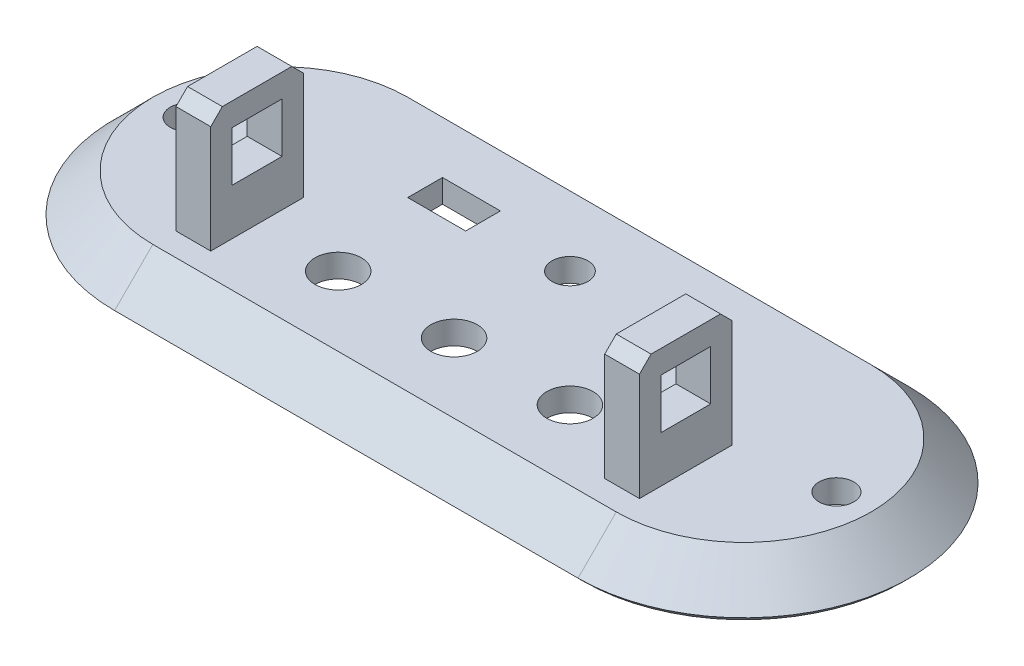
from build123d import *
from OCP.BRepFilletAPI import BRepFilletAPI_MakeChamfer

# Parameters (mm, degrees)
BOSS_EXTRU_1_DEPTH           = 3.8
BOSS_EXTRU_1_TAPER           = 45
COQUE2_DEPTH                 = 1.8
COQUE2_DRAFT                 = 45
CHANFREIN1_SIZE              = 1
CHANFREIN1_SIZE2             = 0.707106781
ENL_V_MAT_EXTRU_1_REACH      = 39.355
ESQUISSE2_R                  = 1.5
ENL_V_MAT_EXTRU_2_REACH      = 39.215
ESQUISSE3_R                  = 1.55
ESQUISSE3_R_2                = 2
ESQUISSE3_W                  = 5
ESQUISSE3_H                  = 3
ESQUISSE4_W                  = 4.3
ESQUISSE4_H                  = 4.3
BOSS_EXTRU_2_DEPTH           = 3
CHANFREIN2_SIZE              = 1
CHANFREIN2_OF_SYM_TRIE1_SIZE = 1


# Read off the part's stored shape, not the designer's step: Coque2
with BuildPart() as part:
    # Esquisse1 → Boss.-Extru.1 (new body)
    with BuildSketch(Plane(origin=(0, 0, 0), x_dir=(1, 0, 0), z_dir=(0, 1, 0))):
        with BuildLine():
            ThreePointArc((-20, 14.8), (-34.8, 0), (-20, -14.8))
            Line((-20, -14.8), (20, -14.8))
            ThreePointArc((20, -14.8), (34.8, 0), (20, 14.8))
            Line((20, 14.8), (-20, 14.8))
        make_face()
    extrude(amount=BOSS_EXTRU_1_DEPTH, taper=BOSS_EXTRU_1_TAPER)


with BuildPart() as coque2_tool:
    # Coque2 outline → Coque2 (with draft: the straight prism first)
    with BuildSketch(Plane(origin=(0, 1.8, 0), x_dir=(1, 0, 0), z_dir=(0, 1, 0))):
        with BuildLine():
            Line((-20, -10.171572875), (20, -10.171572875))
            ThreePointArc((20, -10.171572875), (30.171572875, 0), (20, 10.171572875))
            Line((20, 10.171572875), (-20, 10.171572875))
            ThreePointArc((-20, 10.171572875), (-30.171572875, 0), (-20, -10.171572875))
        make_face()
    extrude(amount=-COQUE2_DEPTH)
    # Coque2: the draft: its side faces are tilted about the plane it starts from
    coque2_sides = [coque2_tool.faces().sort_by_distance(p)[0] for p in [
        (0, 0.9, 10.171572875),
        (30.171572875, 0.9, 0),
        (0, 0.9, -10.171572875),
        (-30.171572875, 0.9, 0),
    ]]
    draft(coque2_sides, Plane(origin=(0, 1.8, 0), x_dir=(1, 0, 0), z_dir=(0, 1, 0)), COQUE2_DRAFT)


with BuildPart() as part_1:
    add(part.part)

    # Coque2: cut by coque2_tool
    add(coque2_tool.part, mode=Mode.SUBTRACT)

    # Chanfrein1: one chamfer whose edges measure the first distance from different faces: ONE call of the kernel's chamfer builder (chamfer() names one face for all edges)
    chanfrein1_edges_1 = [part_1.edges().sort_by_distance(p)[0] for p in [
        (0, 0, -14.8),
        (0, 0, 14.8),
        (-34.8, 0, 0),
    ]]
    chanfrein1_side_1 = [part_1.faces().sort_by_distance(p)[0] for p in [
        (0, 0, -14.043672029),
    ]]
    chanfrein1_edges_2 = [part_1.edges().sort_by_distance(p)[0] for p in [
        (34.8, 0, 0),
    ]]
    chanfrein1_side_2 = [part_1.faces().sort_by_distance(p)[0] for p in [
        (32.9, 1.9, 0),
    ]]
    chanfrein1 = BRepFilletAPI_MakeChamfer(part_1.part.solid().wrapped)
    for e in chanfrein1_edges_1:
        chanfrein1.Add(CHANFREIN1_SIZE, CHANFREIN1_SIZE2, e.wrapped, chanfrein1_side_1[0].wrapped)  # the first distance lies on this face
    for e in chanfrein1_edges_2:
        chanfrein1.Add(CHANFREIN1_SIZE, CHANFREIN1_SIZE2, e.wrapped, chanfrein1_side_2[0].wrapped)  # the first distance lies on this face
    add(Compound.cast(chanfrein1.Shape()), mode=Mode.REPLACE)

    # Esquisse2 → Enlèv. mat.-Extru.1 (cut, up to next)
    with BuildSketch(Plane(origin=(0, 3.8, 0), x_dir=(1, 0, 0), z_dir=(0, 1, 0)), mode=Mode.PRIVATE) as enl_v_mat_extru_1_sk1:
        with Locations(Location((-28, 0, 0), (0, 0, 270))):
            Circle(ESQUISSE2_R)
    enl_v_mat_extru_1_tool1 = extrude(enl_v_mat_extru_1_sk1.sketch, amount=-ENL_V_MAT_EXTRU_1_REACH, mode=Mode.PRIVATE) & part_1.part
    # Esquisse2 → Enlèv. mat.-Extru.1 (cut, up to next)
    with BuildSketch(Plane(origin=(0, 3.8, 0), x_dir=(1, 0, 0), z_dir=(0, 1, 0)), mode=Mode.PRIVATE) as enl_v_mat_extru_1_sk2:
        with Locations(Location((28, 0, 0), (0, 0, 270))):
            Circle(ESQUISSE2_R)
    enl_v_mat_extru_1_tool2 = extrude(enl_v_mat_extru_1_sk2.sketch, amount=-ENL_V_MAT_EXTRU_1_REACH, mode=Mode.PRIVATE) & part_1.part
    add(enl_v_mat_extru_1_tool1.solids().sort_by_distance((-28, 3.8, 0))[0], mode=Mode.SUBTRACT)
    add(enl_v_mat_extru_1_tool2.solids().sort_by_distance((28, 3.8, 0))[0], mode=Mode.SUBTRACT)

    # Esquisse3 → Enlèv. mat.-Extru.2 (cut, up to next)
    with BuildSketch(Plane.XZ.offset(-1.8), mode=Mode.PRIVATE) as enl_v_mat_extru_2_sk1:
        with Locations(Location((0, -5, 0), (0, 0, 270))):
            Circle(ESQUISSE3_R)
    enl_v_mat_extru_2_tool1 = extrude(enl_v_mat_extru_2_sk1.sketch, amount=-ENL_V_MAT_EXTRU_2_REACH, mode=Mode.PRIVATE) & part_1.part
    # Esquisse3 → Enlèv. mat.-Extru.2 (cut, up to next)
    with BuildSketch(Plane.XZ.offset(-1.8), mode=Mode.PRIVATE) as enl_v_mat_extru_2_sk2:
        with Locations(Location((10, 5, 0), (0, 0, 270))):
            Circle(ESQUISSE3_R_2)
    enl_v_mat_extru_2_tool2 = extrude(enl_v_mat_extru_2_sk2.sketch, amount=-ENL_V_MAT_EXTRU_2_REACH, mode=Mode.PRIVATE) & part_1.part
    # Esquisse3 → Enlèv. mat.-Extru.2 (cut, up to next)
    with BuildSketch(Plane.XZ.offset(-1.8), mode=Mode.PRIVATE) as enl_v_mat_extru_2_sk3:
        with Locations(Location((0, 5, 0), (0, 0, 270))):
            Circle(ESQUISSE3_R_2)
    enl_v_mat_extru_2_tool3 = extrude(enl_v_mat_extru_2_sk3.sketch, amount=-ENL_V_MAT_EXTRU_2_REACH, mode=Mode.PRIVATE) & part_1.part
    # Esquisse3 → Enlèv. mat.-Extru.2 (cut, up to next)
    with BuildSketch(Plane.XZ.offset(-1.8), mode=Mode.PRIVATE) as enl_v_mat_extru_2_sk4:
        with Locations(Location((-10, 5, 0), (0, 0, 270))):
            Circle(ESQUISSE3_R_2)
    enl_v_mat_extru_2_tool4 = extrude(enl_v_mat_extru_2_sk4.sketch, amount=-ENL_V_MAT_EXTRU_2_REACH, mode=Mode.PRIVATE) & part_1.part
    # Esquisse3 → Enlèv. mat.-Extru.2 (cut, up to next)
    with BuildSketch(Plane.XZ.offset(-1.8), mode=Mode.PRIVATE) as enl_v_mat_extru_2_sk5:
        with Locations((-10, -5)):
            Rectangle(ESQUISSE3_W, ESQUISSE3_H)
    enl_v_mat_extru_2_tool5 = extrude(enl_v_mat_extru_2_sk5.sketch, amount=-ENL_V_MAT_EXTRU_2_REACH, mode=Mode.PRIVATE) & part_1.part
    add(enl_v_mat_extru_2_tool1.solids().sort_by_distance((0, 1.8, -5))[0], mode=Mode.SUBTRACT)
    add(enl_v_mat_extru_2_tool2.solids().sort_by_distance((10, 1.8, 5))[0], mode=Mode.SUBTRACT)
    add(enl_v_mat_extru_2_tool3.solids().sort_by_distance((0, 1.8, 5))[0], mode=Mode.SUBTRACT)
    add(enl_v_mat_extru_2_tool4.solids().sort_by_distance((-10, 1.8, 5))[0], mode=Mode.SUBTRACT)
    add(enl_v_mat_extru_2_tool5.solids().sort_by_distance((-10, 1.8, -5))[0], mode=Mode.SUBTRACT)

    # Esquisse4 → Boss.-Extru.2 (add)
    with BuildSketch(Plane.ZY.offset(-20)):
        Polygon((9, 3.8), (1, 3.8), (1, 14.1), (5, 14.1), (9, 14.1), align=None)
        with Locations((5, 9.95)):
            Rectangle(ESQUISSE4_W, ESQUISSE4_H, mode=Mode.SUBTRACT)
    boss_extru_2 = extrude(amount=BOSS_EXTRU_2_DEPTH)

    # Chanfrein2
    chanfrein2_edges = [part_1.edges().sort_by_distance(p)[0] for p in [
        (18.5, 14.1, 9),
        (18.5, 14.1, 1),
    ]]
    chamfer(chanfrein2_edges, length=CHANFREIN2_SIZE)

    # Symétrie1: Boss.-Extru.2 across plane
    add(boss_extru_2.mirror(Plane(origin=(0, 0, 0), x_dir=(0, 0, 1), z_dir=(1, 0, 0))))

    # Chanfrein2 of Symétrie1
    chanfrein2_of_sym_trie1_edges = [part_1.edges().sort_by_distance(p)[0] for p in [
        (-18.5, 14.1, 9),
        (-18.5, 14.1, 1),
    ]]
    chamfer(chanfrein2_of_sym_trie1_edges, length=CHANFREIN2_OF_SYM_TRIE1_SIZE)


solid = part_1.part
